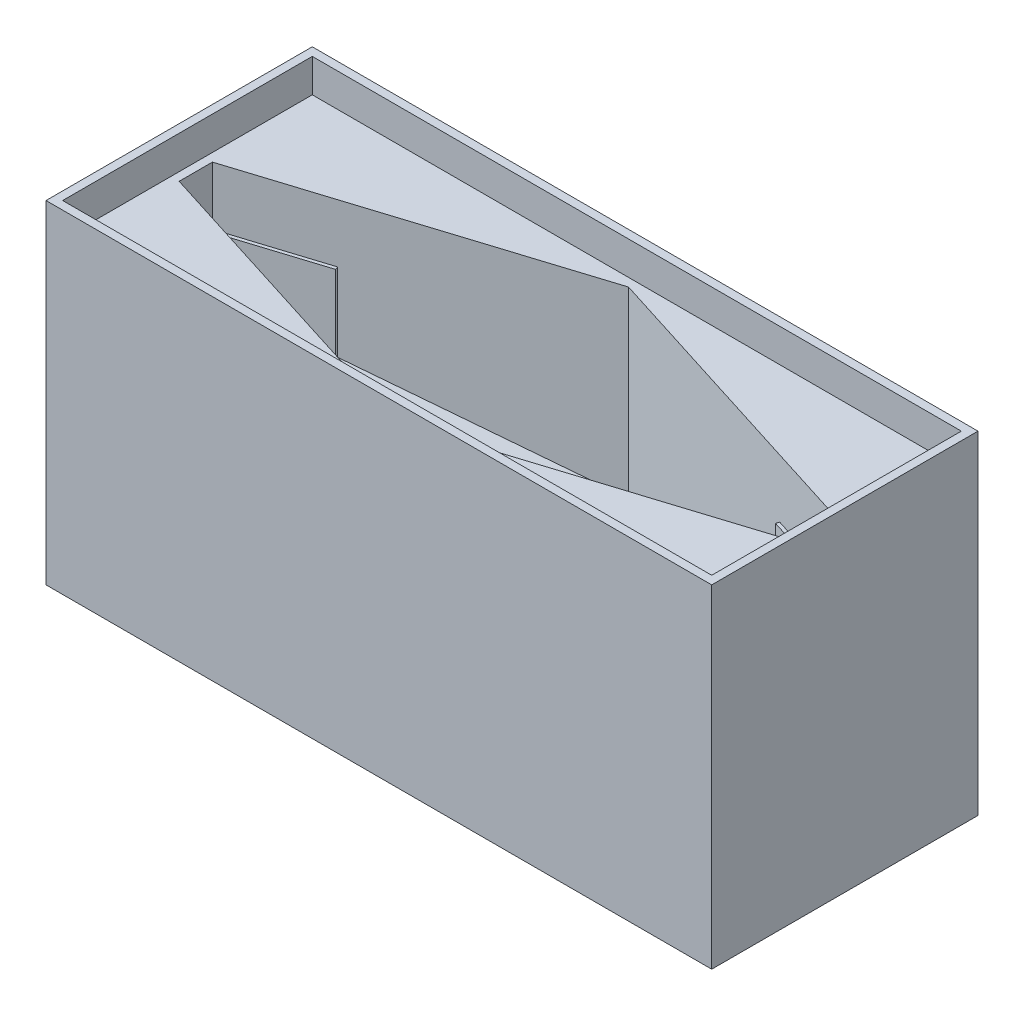
from build123d import *

# Parameters (mm, degrees)
SKETCH_1_W                      = 20
SKETCH_1_H                      = 8
EXTRUDE_1_DEPTH                 = 10
CUT_EXTRUDE_2_DEPTH             = 3
CUT_EXTRUDE_3_REACH             = 16.697
CUT_EXTRUDE_3_DIRECTION_2_REACH = 16.697
CUT_EXTRUDE_START               = 3.5
CUT_EXTRUDE_4_DEPTH             = 3.5
CUT_EXTRUDE_START_2             = -3.424924247
CUT_EXTRUDE_4_2_DEPTH           = 1.95709957
SKETCH_7_W                      = 19.5
SKETCH_7_H                      = 7.5
CUT_EXTRUDE_5_DEPTH             = 1
EXTRUDE_6_DEPTH                 = 0.1
MIRROR_2_COPY_1_DEPTH           = 0.1


with BuildPart() as part:
    # 草圖1 → 伸長1 (new body)
    with BuildSketch(Plane(origin=(0, 0, 0), x_dir=(1, 0, 0), z_dir=(0, 1, 0))):
        Rectangle(SKETCH_1_W, SKETCH_1_H)
    extrude(amount=EXTRUDE_1_DEPTH)

    # 草圖2 → 伸長2 (cut)
    with BuildSketch(Plane(origin=(0, 10, 0), x_dir=(1, 0, 0), z_dir=(0, 1, 0))):
        Polygon((-9.5, 0.5), (-9.5, -0.5), (0, -3.5), (9.5, -0.5), (9.5, 0.5), (0, 3.5), align=None)
    extrude(amount=-CUT_EXTRUDE_2_DEPTH, mode=Mode.SUBTRACT)

    # 伸長3: up to this plane
    cut_extrude_3_end = Plane(origin=(0, 7, -3.5), z_dir=(-0.3011313679370976, 0, -0.9535826651341416))
    # 草圖4 → 伸長3 (cut, up to the surface)
    with BuildSketch(Plane.XY, mode=Mode.PRIVATE) as cut_extrude_3_sk1:
        Polygon((0, 10), (-9.5, 10), (-9.5, 5.5), (0, 3.5), align=None)
    cut_extrude_3_tool1 = split(extrude(cut_extrude_3_sk1.sketch, amount=-CUT_EXTRUDE_3_REACH, mode=Mode.PRIVATE), bisect_by=cut_extrude_3_end, keep=Keep.BOTH, mode=Mode.PRIVATE)
    add(cut_extrude_3_tool1.solids().sort_by_distance((-4.462121, 7.219697, 0))[0], mode=Mode.SUBTRACT)

    # 伸長3 direction 2: up to this plane
    cut_extrude_3_direction_2_end = Plane(origin=(-9.5, 7, 0.5), z_dir=(-0.3011313679370972, 0, 0.9535826651341417))
    # 草圖4 → 伸長3 direction 2 (cut, up to the surface)
    with BuildSketch(Plane.XY, mode=Mode.PRIVATE) as cut_extrude_3_direction_2_sk1:
        Polygon((0, 10), (-9.5, 10), (-9.5, 5.5), (0, 3.5), align=None)
    cut_extrude_3_direction_2_tool1 = split(extrude(cut_extrude_3_direction_2_sk1.sketch, amount=CUT_EXTRUDE_3_DIRECTION_2_REACH, mode=Mode.PRIVATE), bisect_by=cut_extrude_3_direction_2_end, keep=Keep.BOTH, mode=Mode.PRIVATE)
    add(cut_extrude_3_direction_2_tool1.solids().sort_by_distance((-4.462121, 7.219697, 0))[0], mode=Mode.SUBTRACT)

    # 伸長4: read off the stored shape, not the designer's step
    # 伸長4 outline → 伸長4 (cut)
    with BuildSketch(Plane(origin=(0, 0, 0), x_dir=(1, 0, 0), z_dir=(0, 1, 0)).offset(CUT_EXTRUDE_START)):
        Polygon((9.5, -0.5), (9.5, 0.5), (0, 3.5), (0, -3.5), align=None)
    extrude(amount=CUT_EXTRUDE_4_DEPTH, mode=Mode.SUBTRACT)

    # Cut-Extrude 4 2 outline → Cut-Extrude 4 2 (add)
    with BuildSketch(Plane(origin=(0, 0, 0), x_dir=(0.978549784986749, 0.206010481049842, 0), z_dir=(0.206010481049842, -0.978549784986749, 0)).offset(CUT_EXTRUDE_START_2)):
        Polygon((0.721036684, 3.5), (0.721036684, -3.5), (10.429280603, -0.5), (10.429280603, 0.5), align=None)
    extrude(amount=CUT_EXTRUDE_4_2_DEPTH)

    # 草圖7 → 伸長5 (cut)
    with BuildSketch(Plane(origin=(0, 10, 0), x_dir=(1, 0, 0), z_dir=(0, 1, 0))):
        Rectangle(SKETCH_7_W, SKETCH_7_H)
    extrude(amount=-CUT_EXTRUDE_5_DEPTH, mode=Mode.SUBTRACT)

    # 草圖8 → 伸長6 (add)
    with BuildSketch(Plane(origin=(-1.005037783, 0, -3.182619647), x_dir=(0.9535826651341416, 0, -0.3011313679370976), z_dir=(0.3011313679370976, 0, 0.9535826651341416))):
        Polygon((-8.908469635, 5.5), (-8.908469635, 7.25), (-5.908469635, 7.25), (-5.908469635, 4.897737264), align=None)
    extrude_6 = extrude(amount=EXTRUDE_6_DEPTH)

    # 鏡射1: 伸長6 across plane
    add(extrude_6.mirror(Plane.XY))

    # 鏡射2: 伸長6 across plane
    add(extrude_6.mirror(Plane(origin=(0, 0, 0), x_dir=(0, 0, 1), z_dir=(1, 0, 0))))

    # 鏡射2 copy 1 sketch → 鏡射2 copy 1 (add)
    with BuildSketch(Plane(origin=(1.005037783, 0, 3.182619647), x_dir=(-0.9535826651341415, 0, 0.301131367937098), z_dir=(-0.301131367937098, 0, -0.9535826651341415))):
        Polygon((-8.908469635, 5.5), (-8.908469635, 7.25), (-5.908469635, 7.25), (-5.908469635, 4.897737264), align=None)
    extrude(amount=MIRROR_2_COPY_1_DEPTH)


solid = part.part
